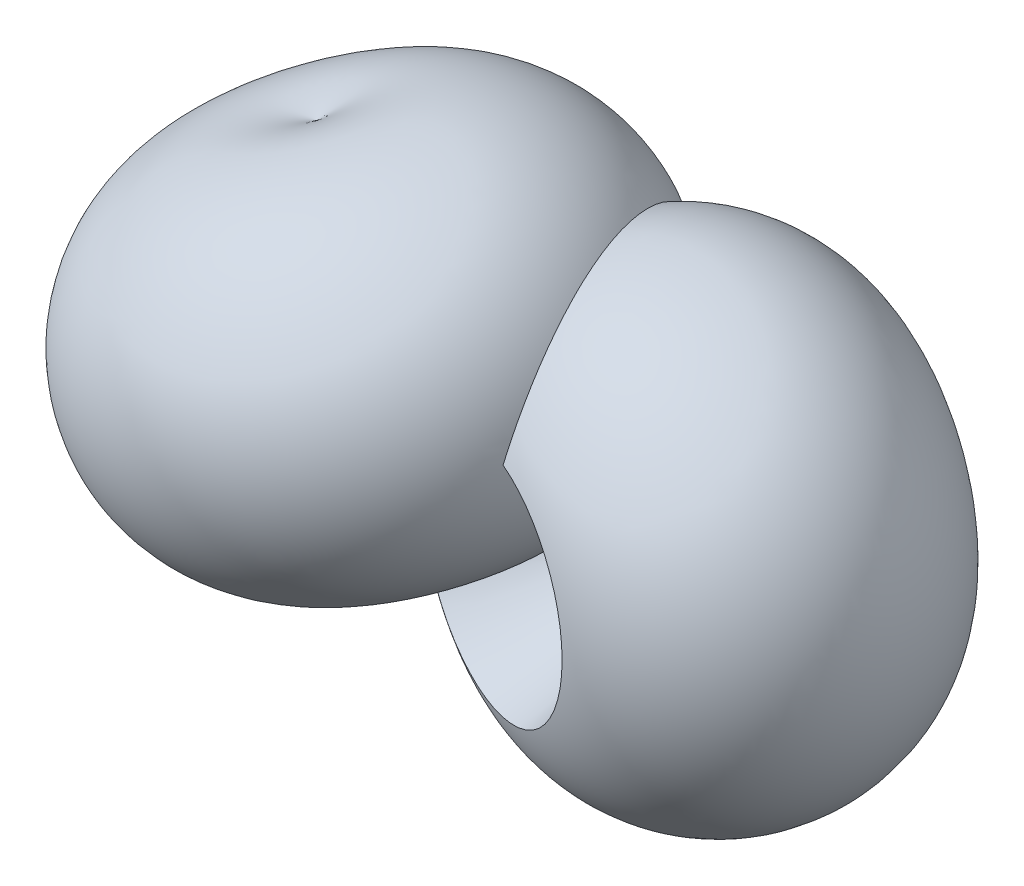
from build123d import *


with BuildPart() as part:
    # Sketch1 → Revolve7 (revolve)
    with BuildSketch(Plane(origin=(0, 0, 0), x_dir=(1, 0, 0), z_dir=(0, 1, 0))):
        with BuildLine():
            Line((26.956589343, -3.447268454), (29.288213831, -20.228723959))
            ThreePointArc((29.288213831, -20.228723959), (59.196940667, 9.680002876), (29.288213831, 39.588729712))
            Line((29.288213831, 39.588729712), (24.846845126, 26.461458381))
            Line((24.846845126, 26.461458381), (43.125939386, 12.722081588))
            Line((43.125939386, 12.722081588), (26.956589343, -3.447268454))
        make_face()
    revolve(axis=Axis((24.846845126, 0, -26.461458381), (0.3204856083303386, 0, -0.9472533847145298)))

    # Sketch2 → Revolve8 (revolve)
    with BuildSketch(Plane.XY):
        with BuildLine():
            Line((-26.956589343, 22.807274207), (-33.507702264, 39.588729712))
            ThreePointArc((-33.507702264, 39.588729712), (-63.4164291, 9.680002876), (-33.507702264, -20.228723959))
            Line((-33.507702264, -20.228723959), (-24.846845126, -7.101452629))
            Line((-24.846845126, -7.101452629), (-33.507702264, 9.680002876))
            Line((-33.507702264, 9.680002876), (-26.956589343, 22.807274207))
        make_face()
    revolve(axis=Axis((-26.956589343, 22.807274207, 0), (-0.3636509811865806, 0.9315352724841058, 0)))


solid = part.part
